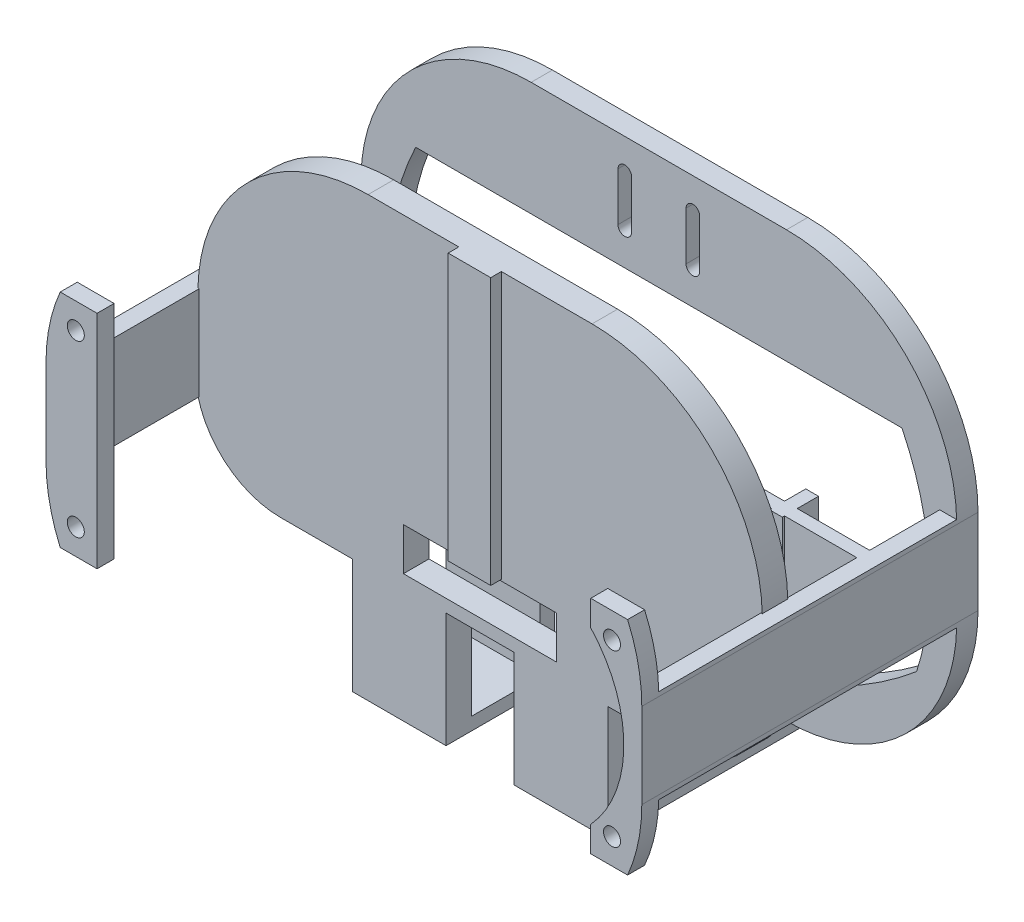
from build123d import *

# Parameters (mm, degrees)
SKETCH1_W                 = 140
SKETCH1_H                 = 100
BOSS_EXTRUDE1_DEPTH       = 5
SKETCH2_W                 = 4
SKETCH2_H                 = 52
BOSS_EXTRUDE2_DEPTH       = 70
SKETCH3_W                 = 12
SKETCH3_H                 = 52
BOSS_EXTRUDE3_DEPTH       = 4
SKETCH4_R                 = 2
CUT_EXTRUDE1_DEPTH        = 4
SKETCH5_W                 = 70
SKETCH5_H                 = 15
CUT_EXTRUDE3_DEPTH        = 169.347854159
FILLET1_R                 = 40
CUT_EXTRUDE6_DEPTH        = 10
SKETCH11_W                = 22
SKETCH11_H                = 41
BOSS_EXTRUDE6_DEPTH       = 3
SKETCH12_W                = 22
SKETCH12_H                = 6
BOSS_EXTRUDE7_DEPTH       = 30
SKETCH15_W                = 132.6
SKETCH15_H                = 76
BOSS_EXTRUDE8_DEPTH       = 6
FILLET2_R                 = 40
FILLET3_R                 = 20
CUT_EXTRUDE13_DEPTH       = 10
SKETCH25_W                = 10
SKETCH25_H                = 62.648578198
BOSS_EXTRUDE9_DEPTH       = 2.5
BOSS_EXTRUDE10_DEPTH      = 16
SKETCH27_W                = 21.5
SKETCH27_H                = 2.5
BOSS_EXTRUDE11_DEPTH      = 26
FILLET4_R                 = 5
SKETCH29_W                = 14
SKETCH29_H                = 10
CUT_EXTRUDE14_DEPTH       = 5
CUT_EXTRUDE15_DEPTH       = 5
SKETCH33_W                = 36
SKETCH33_H                = 3
BOSS_EXTRUDE12_DEPTH      = 22
BOSS_EXTRUDE13_DEPTH      = 5
BOSS_EXTRUDE13_DEPTH_BACK = 3.5
SKETCH34_W                = 22
SKETCH34_H                = 17
SKETCH34_W_2              = 3
SKETCH34_H_2              = 22
SKETCH35_W                = 5
SKETCH35_H                = 17
CUT_EXTRUDE16_DEPTH       = 139.021737418
SKETCH36_W                = 36.01199305
SKETCH36_H                = 10
CUT_EXTRUDE17_DEPTH       = 8


with BuildPart() as part:
    # Sketch1 → Boss-Extrude1 (new body)
    with BuildSketch(Plane.XY):
        Rectangle(SKETCH1_W, SKETCH1_H)
    extrude(amount=BOSS_EXTRUDE1_DEPTH)

    # Sketch2 → Boss-Extrude2 (add)
    with BuildSketch(Plane.XY.offset(5)):
        with Locations((-68, 0)):
            Rectangle(SKETCH2_W, SKETCH2_H)
        with Locations((68, 0)):
            Rectangle(SKETCH2_W, SKETCH2_H)
    extrude(amount=BOSS_EXTRUDE2_DEPTH)

    # Sketch3 → Boss-Extrude3 (add)
    with BuildSketch(Plane.XY.offset(75)):
        with Locations((-64, 0)):
            Rectangle(SKETCH3_W, SKETCH3_H)
        with Locations((64, 0)):
            Rectangle(SKETCH3_W, SKETCH3_H)
    extrude(amount=BOSS_EXTRUDE3_DEPTH)

    # Sketch4 → Cut-Extrude1 (cut)
    with BuildSketch(Plane.XY.offset(79)):
        with Locations((-63, 20)):
            Circle(SKETCH4_R)
        with Locations(Location((-63, -20, 0), (0, 0, 180))):
            Circle(SKETCH4_R)
        with Locations(Location((63, 20, 0), (0, 0, 180))):
            Circle(SKETCH4_R)
        with Locations((63, -20)):
            Circle(SKETCH4_R)
    extrude(amount=-CUT_EXTRUDE1_DEPTH, mode=Mode.SUBTRACT)

    # Sketch5 → Cut-Extrude3 (cut, through all)
    with BuildSketch(Plane.ZY.offset(70)):
        with Locations((40, 18.5)):
            Rectangle(SKETCH5_W, SKETCH5_H)
        with Locations((40, -18.5)):
            Rectangle(SKETCH5_W, SKETCH5_H)
    extrude(amount=-CUT_EXTRUDE3_DEPTH, mode=Mode.SUBTRACT)

    # Fillet1
    fillet1_edges = [part.edges().sort_by_distance(p)[0] for p in [
        (70, -50, 2.5),
        (70, 50, 2.5),
        (-70, 50, 2.5),
        (-70, -50, 2.5),
    ]]
    fillet(fillet1_edges, radius=FILLET1_R)

    # Sketch9 → Cut-Extrude6 (cut)
    with BuildSketch(Plane(origin=(0, 0, 0), x_dir=(-1, 0, 0), z_dir=(0, 0, -1))):
        with BuildLine():
            Line((-6.4, 42.595375442), (-6.4, 31.250081589))
            ThreePointArc((-6.4, 31.250081589), (-8, 29.650081589), (-9.6, 31.250081589))
            Line((-9.6, 31.250081589), (-9.6, 42.595375442))
            ThreePointArc((-9.6, 42.595375442), (-8, 44.195375442), (-6.4, 42.595375442))
        make_face()
        with BuildLine():
            Line((6.4, 42.595375442), (6.4, 31.250081589))
            ThreePointArc((6.4, 31.250081589), (8, 29.650081589), (9.6, 31.250081589))
            Line((9.6, 31.250081589), (9.6, 42.595375442))
            ThreePointArc((9.6, 42.595375442), (8, 44.195375442), (6.4, 42.595375442))
        make_face()
    extrude(amount=-CUT_EXTRUDE6_DEPTH, mode=Mode.SUBTRACT)

    # Sketch11 → Boss-Extrude6 (add)
    with BuildSketch(Plane.XZ.offset(50)):
        with Locations((-19, 20.5)):
            Rectangle(SKETCH11_W, SKETCH11_H)
        with Locations((19, 20.5)):
            Rectangle(SKETCH11_W, SKETCH11_H)
    extrude(amount=BOSS_EXTRUDE6_DEPTH)

    # Sketch12 → Boss-Extrude7 (add)
    with BuildSketch(Plane.XZ.offset(53)):
        with Locations((-19, 44)):
            Rectangle(SKETCH12_W, SKETCH12_H)
        with Locations((19, 44)):
            Rectangle(SKETCH12_W, SKETCH12_H)
    extrude(amount=-BOSS_EXTRUDE7_DEPTH)

    # Sketch15 → Boss-Extrude8 (add)
    with BuildSketch(Plane.XY.offset(47)):
        with Locations((0, 12)):
            Rectangle(SKETCH15_W, SKETCH15_H)
    extrude(amount=-BOSS_EXTRUDE8_DEPTH)

    # Fillet2
    # the kernel refuses this fillet: 40 mm, written as the material it takes off along each edge
    with BuildSketch(Plane(origin=(66.3, 50, 146.968745116), x_dir=(0, -1, 0), z_dir=(0, 0, -1))) as fillet2_piece_1_section:
        with BuildLine():
            CenterArc((40, 39.987498046), FILLET2_R, 180, 88.567456262)
            Line((0, 39.987498046), (0, 0))
            Line((0, 0), (39, 0))
        make_face()
    fillet2_piece_1 = extrude(amount=105.968745116, mode=Mode.PRIVATE)
    fillet2_piece_1 = split(fillet2_piece_1, bisect_by=Plane(origin=(65.992272223, 15.649976228, 75), z_dir=(0, 0, -1)), keep=Keep.TOP, mode=Mode.PRIVATE)
    add(fillet2_piece_1, mode=Mode.SUBTRACT)
    with BuildSketch(Plane(origin=(-66.3, 50, 146.968745116), x_dir=(0, -1, 0), z_dir=(0, 0, -1))) as fillet2_piece_2_section:
        with BuildLine():
            CenterArc((40, -39.987498046), FILLET2_R, 91.432543738, 88.567456262)
            Line((0, -39.987498046), (0, 0))
            Line((0, 0), (39, 0))
        make_face()
    fillet2_piece_2 = extrude(amount=105.968745116, mode=Mode.PRIVATE)
    fillet2_piece_2 = split(fillet2_piece_2, bisect_by=Plane(origin=(-65.992272223, 15.649976228, 75), z_dir=(0, 0, -1)), keep=Keep.TOP, mode=Mode.PRIVATE)
    add(fillet2_piece_2, mode=Mode.SUBTRACT)

    # Fillet3
    # the kernel refuses this fillet: 20 mm, written as the material it takes off along each edge
    with BuildSketch(Plane(origin=(66.3, -26, 47), x_dir=(0, 1, 0), z_dir=(0, 0, -1))) as fillet3_piece_1_section:
        with BuildLine():
            CenterArc((20, -19.364916731), FILLET3_R, 104.477512186, 75.522487814)
            Line((0, -19.364916731), (0, 0))
            Line((0, 0), (15, 0))
        make_face()
    fillet3_piece_1 = extrude(amount=54.412291828, mode=Mode.PRIVATE)
    fillet3_piece_1 = split(fillet3_piece_1, bisect_by=Plane(origin=(64.996360144, -14.682849628, 5), z_dir=(0, 0, 1)), keep=Keep.TOP, mode=Mode.PRIVATE)
    add(fillet3_piece_1, mode=Mode.SUBTRACT)
    with BuildSketch(Plane(origin=(-66.3, -26, 47), x_dir=(1, 0, 0), z_dir=(0, 0, -1))) as fillet3_piece_2_section:
        with BuildLine():
            CenterArc((19.364916731, -20), FILLET3_R, 90, 75.522487814)
            Line((0, -15), (0, 0))
            Line((0, 0), (19.364916731, 0))
        make_face()
    fillet3_piece_2 = extrude(amount=54.412291828, mode=Mode.PRIVATE)
    fillet3_piece_2 = split(fillet3_piece_2, bisect_by=Plane(origin=(-52.725602454, -25.185189276, 5), z_dir=(0, 0, 1)), keep=Keep.TOP, mode=Mode.PRIVATE)
    add(fillet3_piece_2, mode=Mode.SUBTRACT)

    # Sketch24 → Cut-Extrude13 (cut)
    with BuildSketch(Plane(origin=(0, 0, 0), x_dir=(-1, 0, 0), z_dir=(0, 0, -1))):
        with BuildLine():
            Line((57.127807538, 23.220760353), (-57.127807538, 23.220760353))
            ThreePointArc((-57.127807538, 23.220760353), (-63.480824357, -0.367653581), (-60.579297228, -24.623688601))
            ThreePointArc((-60.579297228, -24.623688601), (0, -46.779239647), (60.579297228, -24.623688601))
            ThreePointArc((60.579297228, -24.623688601), (63.401945013, -0.373343922), (57.127807538, 23.220760353))
        make_face()
    extrude(amount=-CUT_EXTRUDE13_DEPTH, mode=Mode.SUBTRACT)

    # Sketch25 → Boss-Extrude9 (add)
    with BuildSketch(Plane.XY.offset(47)):
        with Locations((0, 18.675710901)):
            Rectangle(SKETCH25_W, SKETCH25_H)
    extrude(amount=BOSS_EXTRUDE9_DEPTH)

    # Sketch26 → Boss-Extrude10 (add)
    with BuildSketch(Plane(origin=(0, 0, 41), x_dir=(-1, 0, 0), z_dir=(0, 0, -1))):
        Polygon((-10.75, -13), (-10.75, -11), (-10.75, 11), (-10.75, 13), (-13, 13), (-13, -13), align=None)
        Polygon((10.75, 11), (10.75, -11), (10.75, -13), (13, -13), (13, 13), (10.75, 13), align=None)
    extrude(amount=BOSS_EXTRUDE10_DEPTH)

    # Sketch27 → Boss-Extrude11 (add)
    with BuildSketch(Plane(origin=(0, 13, 0), x_dir=(1, 0, 0), z_dir=(0, 1, 0))):
        with Locations((0, -34.75)):
            Rectangle(SKETCH27_W, SKETCH27_H)
    extrude(amount=-BOSS_EXTRUDE11_DEPTH)

    # Fillet4
    fillet4_edges = [part.edges().sort_by_distance(p)[0] for p in [
        (13, 0, 41),
        (-13, 0, 41),
    ]]
    fillet(fillet4_edges, radius=FILLET4_R)

    # Sketch29 → Cut-Extrude14 (cut)
    with BuildSketch(Plane(origin=(0, 0, 33.5), x_dir=(-1, 0, 0), z_dir=(0, 0, -1))):
        with Locations((-3.75, -8)):
            Rectangle(SKETCH29_W, SKETCH29_H)
    extrude(amount=-CUT_EXTRUDE14_DEPTH, mode=Mode.SUBTRACT)

    # Sketch30 → Cut-Extrude15 (cut)
    with BuildSketch(Plane(origin=(0, 0, 75), x_dir=(-1, 0, 0), z_dir=(0, 0, -1))):
        with BuildLine():
            Line((-58, 20), (-58, -20))
            ThreePointArc((-58, -20), (-65.783189716, 0), (-58, 20))
        make_face()
    extrude(amount=-CUT_EXTRUDE15_DEPTH, mode=Mode.SUBTRACT)

    # Sketch33 → Boss-Extrude12 (add)
    with BuildSketch(Plane(origin=(0, 11, 0), x_dir=(1, 0, 0), z_dir=(0, 1, 0))):
        with Locations((-48, -23.5)):
            Rectangle(SKETCH33_W, SKETCH33_H)
        with Locations((48, -22.973655472)):
            Rectangle(SKETCH33_W, SKETCH33_H)
    extrude(amount=-BOSS_EXTRUDE12_DEPTH)

    # Sketch34 → Boss-Extrude13 (add, two sides: drawn at the far end of the back side and taken through both)
    with BuildSketch(Plane(origin=(0, 0, 21.473655472), x_dir=(-1, 0, 0), z_dir=(0, 0, -1)).offset(-BOSS_EXTRUDE13_DEPTH_BACK)):
        with Locations((19, -41.5)):
            Rectangle(SKETCH34_W, SKETCH34_H)
        with Locations((47.5, 0)):
            Rectangle(SKETCH34_W_2, SKETCH34_H_2)
        with Locations((-19, -41.5)):
            Rectangle(SKETCH34_W, SKETCH34_H)
        with Locations((-47.5, 0)):
            Rectangle(SKETCH34_W_2, SKETCH34_H_2)
    extrude(amount=BOSS_EXTRUDE13_DEPTH + BOSS_EXTRUDE13_DEPTH_BACK)

    # Sketch35 → Cut-Extrude16 (cut, through all)
    with BuildSketch(Plane.ZY.offset(30)):
        with Locations((18.973655472, -41.5)):
            Rectangle(SKETCH35_W, SKETCH35_H)
    extrude(amount=-CUT_EXTRUDE16_DEPTH, mode=Mode.SUBTRACT)

    # Sketch36 → Cut-Extrude17 (cut)
    with BuildSketch(Plane(origin=(0, 0, 41), x_dir=(-1, 0, 0), z_dir=(0, 0, -1))):
        with Locations((0.005996525, -18)):
            Rectangle(SKETCH36_W, SKETCH36_H)
    extrude(amount=-CUT_EXTRUDE17_DEPTH, mode=Mode.SUBTRACT)


solid = part.part
